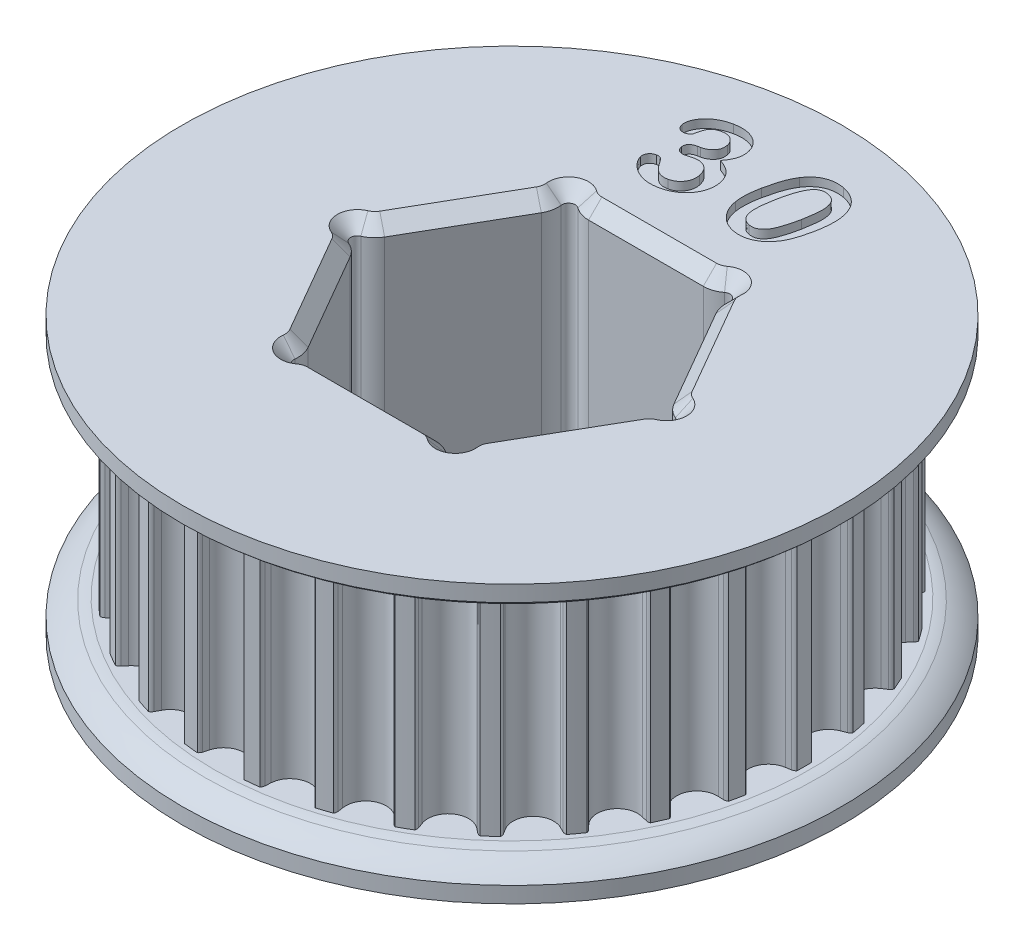
from build123d import *

# Parameters (mm, degrees)
SKETCH1_R               = 13.942945337
TOOTHOD_DEPTH           = 5.08
TOOTHPROFILE_DEPTH      = 21.362167108
TOOTHPATTERN_COUNT      = 30
BORE_DEPTH              = 24.192866588
BORE_DEPTH_BACK         = 24.192866588
LARGE_START             = 6.204
LARGE_TOOTH_COUNT_DEPTH = 0.4
SKETCH12_R              = 0.3175
CUT_EXTRUDE1_DEPTH      = 26.860153032
FILLET1_R               = 1.27
CHAMFER1_SIZE           = 0.635


# Read off the part's stored shape, not the designer's step: Large Tooth Count
with BuildPart() as part:
    # Sketch1 → ToothOD (new, symmetric)
    with BuildSketch(Plane(origin=(0, 0, 0), x_dir=(1, 0, 0), z_dir=(0, 1, 0))):
        with Locations(Location((0, 0, 0), (0, 0, 270))):
            Circle(SKETCH1_R)
    extrude(amount=TOOTHOD_DEPTH, both=True)

    # Sketch2 → ToothProfile (cut, symmetric)
    with BuildSketch(Plane(origin=(0, 0, 0), x_dir=(1, 0, 0), z_dir=(0, 1, 0))):
        with BuildLine():
            ThreePointArc((-0.937033068, 13.493007333), (-0.590385173, 12.974832723), (0, 12.774545337))
            ThreePointArc((0, 12.774545337), (0.590385173, 12.974832723), (0.937033068, 13.493007333))
            ThreePointArc((0.937033068, 13.493007333), (0.971699064, 13.619118795), (1.007805813, 13.744825337))
            ThreePointArc((1.007805813, 13.744825337), (1.04827578, 13.830028138), (1.113221937, 13.898433782))
            ThreePointArc((1.113221937, 13.898433782), (0, 13.942945337), (-1.113221937, 13.898433782))
            ThreePointArc((-1.113221937, 13.898433782), (-1.04827578, 13.830028138), (-1.007805813, 13.744825337))
            ThreePointArc((-1.007805813, 13.744825337), (-0.971699064, 13.619118795), (-0.937033068, 13.493007333))
        make_face()
    toothprofile = extrude(amount=TOOTHPROFILE_DEPTH, both=True, mode=Mode.SUBTRACT)

    # ToothPattern: ToothProfile ×30 about axis
    toothpattern_axis = Axis((0, 0, 0), (0, 1, 0))
    for i in range(1, TOOTHPATTERN_COUNT):
        add(toothprofile.rotate(toothpattern_axis, i * 360 / TOOTHPATTERN_COUNT), mode=Mode.SUBTRACT)

    # Sketch4 → Flange (revolve)
    with BuildSketch(Plane.XY, mode=Mode.PRIVATE) as flange_sk:
        with BuildLine():
            Line((0, -5.08), (14.196945337, -5.08))
            ThreePointArc((14.196945337, -5.08), (14.426591958, -5.115951298), (14.652017665, -5.172637424))
            ThreePointArc((14.652017665, -5.172637424), (15.219746242, -5.454197125), (15.720945337, -5.842))
            Line((15.720945337, -5.842), (15.720945337, -6.604))
            Line((15.720945337, -6.604), (0, -6.604))
            Line((0, -6.604), (0, -5.08))
        make_face()
        with BuildLine():
            Line((15.720945337, 6.604), (15.720945337, 5.842))
            ThreePointArc((15.720945337, 5.842), (15.219746242, 5.454197125), (14.652017665, 5.172637424))
            ThreePointArc((14.652017665, 5.172637424), (14.426591958, 5.115951298), (14.196945337, 5.08))
            Line((14.196945337, 5.08), (0, 5.08))
            Line((0, 5.08), (0, 6.604))
            Line((0, 6.604), (15.720945337, 6.604))
        make_face()
    revolve(flange_sk.sketch.rotate(Axis((0, 8.73125, 0), (0, -1, 0)), 90), axis=Axis((0, 8.73125, 0), (0, -1, 0)))

    # Sketch7 → Bore (cut, two sides: drawn at the far end of the back side and taken through both)
    with BuildSketch(Plane.XZ.offset(-BORE_DEPTH_BACK)):
        Polygon((3.688171255, 6.3881), (-3.688171255, 6.3881), (-7.376342509, 0), (-3.688171255, -6.3881), (3.688171255, -6.3881), (7.376342509, 0), align=None)
    extrude(amount=BORE_DEPTH + BORE_DEPTH_BACK, mode=Mode.SUBTRACT)

    # Large Tooth Count outline → Large Tooth Count (cut)
    # profile 1 of 2: a face of its own
    with BuildSketch(Plane(origin=(0, 0, 0), x_dir=(1, 0, 0), z_dir=(0, 1, 0)).offset(LARGE_START)):
        with BuildLine():
            add(Edge.make_bspline(
                [(3.79333125, 12.049422656), (3.80295948, 12.00370364), (3.822909298, 11.908973243), (3.839934178, 11.759322164), (3.847830972, 11.598568062), (3.845403862, 11.426870198), (3.834720655, 11.244188528), (3.813775106, 11.050562966), (3.783444974, 10.84559573), (3.75637949, 10.706002666), (3.742432031, 10.634067187)],
                knots=[0, 0, 0, 0, 0.098209665, 0.203491703, 0.316304971, 0.436495508, 0.564411761, 0.701005585, 0.845921381, 1, 1, 1, 1], degree=3))
            add(Edge.make_bspline(
                [(2.656582031, 13.166526562), (2.706206849, 13.155132675), (2.803280318, 13.132844548), (2.94259136, 13.086337807), (3.071736883, 13.028103956), (3.191370893, 12.958924604), (3.301133537, 12.879562268), (3.401403565, 12.790147143), (3.491932185, 12.691098378), (3.571195273, 12.581049527), (3.64270375, 12.462621366), (3.702802479, 12.333654233), (3.754304174, 12.195380289), (3.780133676, 12.098780354), (3.79333125, 12.049422656)],
                knots=[0, 0, 0, 0, 0.090152796, 0.176352178, 0.259651945, 0.340679802, 0.420727392, 0.499147058, 0.578272523, 0.657893561, 0.739002001, 0.822964899, 0.909543988, 1, 1, 1, 1], degree=3))
            add(Edge.make_bspline(
                [(1.173360938, 12.536090625), (1.19564708, 12.568475682), (1.239439637, 12.632112739), (1.309876572, 12.722043796), (1.385379435, 12.80326932), (1.463717976, 12.877766601), (1.546382669, 12.944036096), (1.632321887, 13.00315336), (1.721642673, 13.055310869), (1.815070316, 13.098996641), (1.911135191, 13.135579536), (2.010219263, 13.164530113), (2.111823638, 13.184843484), (2.216010824, 13.1974155), (2.322610005, 13.201900957), (2.431748708, 13.197738987), (2.543820042, 13.187862345), (2.61857504, 13.173717895), (2.656582031, 13.166526562)],
                knots=[0, 0, 0, 0, 0.068450482, 0.134506083, 0.198696985, 0.261397333, 0.32259497, 0.382979431, 0.44289939, 0.502488886, 0.562366234, 0.621745712, 0.682025526, 0.742587693, 0.804322948, 0.86759274, 0.932681402, 1, 1, 1, 1], degree=3))
            add(Edge.make_bspline(
                [(0.702766406, 11.194851563), (0.717518862, 11.26519424), (0.746304912, 11.402451919), (0.795571225, 11.601658214), (0.847978183, 11.789071165), (0.90385964, 11.964480499), (0.96446555, 12.126861213), (1.028594768, 12.276407029), (1.09639016, 12.412817483), (1.14831297, 12.495974859), (1.173360938, 12.536090625)],
                knots=[0, 0, 0, 0, 0.150859184, 0.294367262, 0.430657714, 0.559291409, 0.680684962, 0.794312984, 0.900774981, 1, 1, 1, 1], degree=3))
            add(Edge.make_bspline(
                [(0.644723437, 10.008096094), (0.638642526, 10.051800398), (0.62630634, 10.140462185), (0.615500251, 10.276683221), (0.613264488, 10.417696474), (0.617724523, 10.563713236), (0.629736602, 10.714706791), (0.647630451, 10.870765397), (0.671603874, 11.031631495), (0.692265669, 11.139851826), (0.702766406, 11.194851563)],
                knots=[0, 0, 0, 0, 0.110816528, 0.224810611, 0.342958202, 0.464879995, 0.591603543, 0.723291302, 0.859371106, 1, 1, 1, 1], degree=3))
            add(Edge.make_bspline(
                [(1.794867187, 8.76061875), (1.757796481, 8.76895007), (1.68470395, 8.785376984), (1.578692012, 8.82022096), (1.476675673, 8.860522245), (1.379895209, 8.910638347), (1.286656653, 8.96627254), (1.199065463, 9.031260904), (1.11583816, 9.102909474), (1.037001008, 9.181177406), (0.965366205, 9.26703746), (0.89879616, 9.357482146), (0.838782928, 9.453126056), (0.786187527, 9.554158241), (0.740572541, 9.660223984), (0.701101372, 9.771069082), (0.668904031, 9.887535787), (0.652864919, 9.96750406), (0.644723437, 10.008096094)],
                knots=[0, 0, 0, 0, 0.063013357, 0.124243807, 0.184962126, 0.244824632, 0.304882435, 0.36494633, 0.425537954, 0.487006996, 0.549046882, 0.61088984, 0.673245472, 0.736208478, 0.799702013, 0.864689897, 0.931316357, 1, 1, 1, 1], degree=3))
            add(Edge.make_bspline(
                [(3.180754687, 9.264253125), (3.157871319, 9.238339502), (3.112408772, 9.186856728), (3.039152131, 9.116067869), (2.9637652, 9.050064281), (2.885426692, 8.990658812), (2.8048367, 8.936587878), (2.721160657, 8.88907576), (2.63496381, 8.847278953), (2.517451736, 8.799676867), (2.365781878, 8.756326636), (2.178312896, 8.730516303), (1.986365835, 8.729537419), (1.859281577, 8.750163925), (1.794867187, 8.76061875)],
                knots=[0, 0, 0, 0, 0.066903371, 0.132917389, 0.197045886, 0.260779646, 0.323109482, 0.384791342, 0.446902374, 0.508430619, 0.630088147, 0.75110531, 0.873844332, 1, 1, 1, 1], degree=3))
            add(Edge.make_bspline(
                [(3.742432031, 10.634067187), (3.726295378, 10.558340978), (3.695171685, 10.412283466), (3.641678743, 10.203431187), (3.584650967, 10.012311882), (3.523425044, 9.837691486), (3.454100306, 9.677001753), (3.374462336, 9.528516449), (3.284684763, 9.389781631), (3.215227641, 9.305890142), (3.180754687, 9.264253125)],
                knots=[0, 0, 0, 0, 0.155098438, 0.29914731, 0.431769474, 0.554551464, 0.669651875, 0.781967595, 0.891786174, 1, 1, 1, 1], degree=3))
        make_face()
        with BuildLine():
            add(Edge.make_bspline(
                [(1.913632031, 9.391054688), (1.936191106, 9.38694552), (1.980185713, 9.37893184), (2.045763475, 9.376169625), (2.108911071, 9.377120318), (2.169393074, 9.386316528), (2.227667826, 9.401443932), (2.282542724, 9.423991977), (2.335506687, 9.451969145), (2.403091961, 9.499508781), (2.481822438, 9.575759873), (2.568295205, 9.6856682), (2.644534424, 9.81897376), (2.700601492, 9.944710055), (2.743549964, 10.056346982), (2.775688425, 10.14928192), (2.806502535, 10.249549545), (2.83842757, 10.356386286), (2.8666493, 10.470972631), (2.898301591, 10.591595098), (2.925859938, 10.719988705), (2.944440044, 10.807895221), (2.953940625, 10.852844531)],
                knots=[0, 0, 0, 0, 0.034322192, 0.066934986, 0.09817343, 0.128833214, 0.15837243, 0.188193233, 0.21752966, 0.247971246, 0.311715644, 0.380966107, 0.456937588, 0.541184412, 0.5870788, 0.636172085, 0.688515898, 0.744276078, 0.803241566, 0.865343089, 0.931145772, 1, 1, 1, 1], degree=3))
            add(Edge.make_bspline(
                [(1.519832813, 11.11805625), (1.511017323, 11.074037933), (1.493773916, 10.98793656), (1.471625542, 10.861374205), (1.452620291, 10.740537153), (1.437576544, 10.625256237), (1.425232976, 10.51569431), (1.414584888, 10.411887693), (1.409872652, 10.313826042), (1.405715218, 10.193850961), (1.409976085, 10.055502488), (1.432295682, 9.903419688), (1.467453367, 9.768934219), (1.520446003, 9.652923922), (1.590923619, 9.555124537), (1.681918125, 9.47873684), (1.790886115, 9.421901023), (1.871680589, 9.401597183), (1.913632031, 9.391054688)],
                knots=[0, 0, 0, 0, 0.068200355, 0.133402288, 0.195185331, 0.254025261, 0.31000668, 0.362698789, 0.412516234, 0.459113992, 0.545092877, 0.622348653, 0.692232855, 0.755558915, 0.815072705, 0.873785642, 0.934464896, 1, 1, 1, 1], degree=3))
            add(Edge.make_bspline(
                [(2.542282031, 12.535197656), (2.510228965, 12.540610223), (2.447897413, 12.551135695), (2.355155361, 12.55080467), (2.267169473, 12.538045332), (2.185158847, 12.509404991), (2.107646091, 12.469091598), (2.037103622, 12.413069325), (1.969950233, 12.345664248), (1.909739947, 12.262917379), (1.852355154, 12.167472424), (1.79856556, 12.058011501), (1.745774289, 11.935645626), (1.69597424, 11.798941812), (1.64794977, 11.64852004), (1.602960636, 11.483881359), (1.558685897, 11.305992894), (1.533083611, 11.182151822), (1.519832813, 11.11805625)],
                knots=[0, 0, 0, 0, 0.049883832, 0.097005903, 0.141910465, 0.185891973, 0.229892514, 0.27555509, 0.323757438, 0.375729045, 0.432377302, 0.494779801, 0.563021864, 0.637130541, 0.718298347, 0.805651304, 0.899412281, 1, 1, 1, 1], degree=3))
            add(Edge.make_bspline(
                [(2.953940625, 10.852844531), (2.970100217, 10.936663066), (3.000891971, 11.096377469), (3.034227598, 11.326082692), (3.054181678, 11.533507079), (3.062586089, 11.719587665), (3.05642304, 11.885890677), (3.034730753, 12.033797688), (2.997872968, 12.164190151), (2.944472978, 12.277221692), (2.872316409, 12.372256405), (2.780543414, 12.448028722), (2.668852714, 12.504640553), (2.585717069, 12.524711429), (2.542282031, 12.535197656)],
                knots=[0, 0, 0, 0, 0.132037801, 0.251595171, 0.358900261, 0.454285871, 0.539549896, 0.615937084, 0.685005529, 0.748434951, 0.808205655, 0.86804549, 0.931059066, 1, 1, 1, 1], degree=3))
        make_face(mode=Mode.SUBTRACT)
    # profile 2 of 2: a face of its own
    with BuildSketch(Plane(origin=(0, 0, 0), x_dir=(1, 0, 0), z_dir=(0, 1, 0)).offset(LARGE_START)):
        with BuildLine():
            add(Edge.make_bspline(
                [(-2.907567822, 10.987652963), (-2.911020111, 11.0117193), (-2.917671531, 11.058087185), (-2.909874272, 11.12733624), (-2.888474163, 11.192085305), (-2.850548449, 11.251221072), (-2.797912661, 11.303833895), (-2.728632533, 11.346660506), (-2.645208595, 11.381637982), (-2.583123729, 11.395547556), (-2.550380322, 11.402883432)],
                knots=[0, 0, 0, 0, 0.117439719, 0.226267565, 0.334404554, 0.445288529, 0.563637655, 0.692116396, 0.837622945, 1, 1, 1, 1], degree=3))
            add(Edge.make_bspline(
                [(-2.50216001, 10.734942807), (-2.527973056, 10.730888299), (-2.577047848, 10.723180021), (-2.649199277, 10.724266576), (-2.714239947, 10.739555135), (-2.772002705, 10.766694832), (-2.821456645, 10.805967518), (-2.860822936, 10.85700761), (-2.891202858, 10.918311476), (-2.901945548, 10.963830309), (-2.907567822, 10.987652963)],
                knots=[0, 0, 0, 0, 0.144370241, 0.274471271, 0.396265647, 0.511142994, 0.624786851, 0.742034498, 0.864991642, 1, 1, 1, 1], degree=3))
            add(Edge.make_bspline(
                [(-2.164617822, 10.826918588), (-2.17565662, 10.8246444), (-2.20055828, 10.819514218), (-2.241434525, 10.808233563), (-2.290749354, 10.795261624), (-2.344285921, 10.778595394), (-2.396920901, 10.763963975), (-2.441224432, 10.74997546), (-2.475255472, 10.741016464), (-2.494412337, 10.736691831), (-2.50216001, 10.734942807)],
                knots=[0, 0, 0, 0, 0.096592829, 0.217897078, 0.363363739, 0.53371412, 0.698449031, 0.831649283, 0.931913378, 1, 1, 1, 1], degree=3))
            add(Edge.make_bspline(
                [(-1.301117041, 10.242917025), (-1.307193042, 10.270426788), (-1.319078446, 10.324239262), (-1.344395643, 10.400845048), (-1.373721462, 10.472174756), (-1.408552622, 10.537307788), (-1.448138758, 10.596962589), (-1.492718946, 10.650911137), (-1.543296187, 10.698240919), (-1.597791303, 10.740449525), (-1.65650148, 10.776492507), (-1.719650926, 10.803805257), (-1.785369718, 10.825463875), (-1.854654836, 10.841158103), (-1.927836848, 10.847780177), (-2.003990776, 10.847430107), (-2.08350986, 10.841478355), (-2.137002976, 10.831875755), (-2.164617822, 10.826918588)],
                knots=[0, 0, 0, 0, 0.071431919, 0.139729604, 0.204381507, 0.26688073, 0.326780298, 0.385758869, 0.443983301, 0.502134232, 0.560412505, 0.618224132, 0.676252356, 0.735798644, 0.79801438, 0.862201554, 0.928864065, 1, 1, 1, 1], degree=3))
            add(Edge.make_bspline(
                [(-1.894048291, 9.334767807), (-1.864034942, 9.342019437), (-1.803997056, 9.356525402), (-1.718095519, 9.392549277), (-1.63500257, 9.436859605), (-1.557697471, 9.493553506), (-1.485897505, 9.559355048), (-1.42299477, 9.635466912), (-1.371273193, 9.721676475), (-1.328044272, 9.815001877), (-1.297540124, 9.915869027), (-1.282251505, 10.022090362), (-1.283288558, 10.132227454), (-1.295093074, 10.205516743), (-1.301117041, 10.242917025)],
                knots=[0, 0, 0, 0, 0.076639119, 0.153306805, 0.2307807, 0.310256727, 0.390888456, 0.472361089, 0.554715906, 0.640137892, 0.727448796, 0.81565797, 0.905928356, 1, 1, 1, 1], degree=3))
            add(Edge.make_bspline(
                [(-2.879885791, 9.966989682), (-2.842161736, 9.908262428), (-2.770950625, 9.797403906), (-2.655412662, 9.650785089), (-2.54596033, 9.527581873), (-2.451776394, 9.444971426), (-2.375369029, 9.393354819), (-2.315693796, 9.364105015), (-2.253411391, 9.340303937), (-2.187200301, 9.32571391), (-2.118488066, 9.316115802), (-2.046352828, 9.316180502), (-1.971002158, 9.320986547), (-1.92017782, 9.330088408), (-1.894048291, 9.334767807)],
                knots=[0, 0, 0, 0, 0.165494384, 0.312401169, 0.442363846, 0.556028008, 0.608516533, 0.660623665, 0.713353888, 0.766282329, 0.82111266, 0.877609238, 0.937077136, 1, 1, 1, 1], degree=3))
            add(Edge.make_bspline(
                [(-3.171886572, 10.069681088), (-3.14385434, 10.073198771), (-3.086866668, 10.080349987), (-3.016159411, 10.062377337), (-2.963653751, 10.040866753), (-2.929245884, 10.020200304), (-2.900553642, 9.996098825), (-2.886665266, 9.976538072), (-2.879885791, 9.966989682)],
                knots=[0, 0, 0, 0, 0.25801308, 0.524523507, 0.658326607, 0.779999686, 0.892608999, 1, 1, 1, 1], degree=3))
            add(Edge.make_bspline(
                [(-3.484425635, 9.618731869), (-3.488513103, 9.645754524), (-3.496408536, 9.697952022), (-3.48974961, 9.775572612), (-3.468299589, 9.848133199), (-3.429821823, 9.91311879), (-3.380453131, 9.970640358), (-3.31883733, 10.015524204), (-3.249260159, 10.05065411), (-3.198127535, 10.063228159), (-3.171886572, 10.069681088)],
                knots=[0, 0, 0, 0, 0.132938278, 0.256786215, 0.37668058, 0.498977948, 0.622467818, 0.743865292, 0.868553173, 1, 1, 1, 1], degree=3))
            add(Edge.make_bspline(
                [(-1.785106104, 8.762374838), (-1.842999642, 8.752308355), (-1.956153802, 8.732633199), (-2.125300666, 8.722845227), (-2.288444786, 8.730704508), (-2.444641373, 8.755666495), (-2.591695194, 8.795800035), (-2.729678863, 8.843977586), (-2.856373936, 8.904247923), (-2.971592963, 8.974130076), (-3.075959637, 9.05099133), (-3.169580085, 9.132350915), (-3.253766646, 9.216384507), (-3.32505813, 9.303984015), (-3.384238734, 9.390405459), (-3.430828516, 9.471567902), (-3.466028682, 9.546153589), (-3.478556953, 9.595579184), (-3.484425635, 9.618731869)],
                knots=[0, 0, 0, 0, 0.084858105, 0.165856982, 0.244232561, 0.320459077, 0.393907119, 0.464241528, 0.531385461, 0.596223663, 0.658678463, 0.718440469, 0.775314216, 0.830331254, 0.881391247, 0.926470742, 0.965556313, 1, 1, 1, 1], degree=3))
            add(Edge.make_bspline(
                [(-0.510839697, 10.452764682), (-0.503345139, 10.408226317), (-0.4883779, 10.319279609), (-0.482909614, 10.183935204), (-0.489690789, 10.048099299), (-0.511439263, 9.912933302), (-0.545857927, 9.779535454), (-0.595588259, 9.650001857), (-0.659364222, 9.524844107), (-0.736159432, 9.404060105), (-0.826203591, 9.290058739), (-0.928884195, 9.183964629), (-1.043609397, 9.086335449), (-1.17039691, 8.998137733), (-1.308403836, 8.920151261), (-1.457259536, 8.854056962), (-1.616837008, 8.799845892), (-1.72827521, 8.775030242), (-1.785106104, 8.762374838)],
                knots=[0, 0, 0, 0, 0.057352876, 0.11453832, 0.171742531, 0.229957309, 0.28822369, 0.346537948, 0.405922237, 0.466475902, 0.528158226, 0.590227966, 0.653829397, 0.719315559, 0.786228555, 0.854984433, 0.926045431, 1, 1, 1, 1], degree=3))
            add(Edge.make_bspline(
                [(-1.420774854, 11.3609139), (-1.379768236, 11.34753806), (-1.299429209, 11.321332485), (-1.185212143, 11.272428436), (-1.07793184, 11.219447087), (-0.980039443, 11.158069696), (-0.888760645, 11.092819194), (-0.808706982, 11.018421497), (-0.735057632, 10.940254777), (-0.673108733, 10.853530761), (-0.617889125, 10.762256205), (-0.572376758, 10.664699496), (-0.53634402, 10.561034633), (-0.519434889, 10.489252654), (-0.510839697, 10.452764682)],
                knots=[0, 0, 0, 0, 0.095378747, 0.186863396, 0.274624743, 0.359785527, 0.4422375, 0.522414957, 0.60117637, 0.67941575, 0.757680067, 0.836927252, 0.917107413, 1, 1, 1, 1], degree=3))
            add(Edge.make_bspline(
                [(-1.113593604, 12.373540463), (-1.105535205, 12.326056531), (-1.089847899, 12.233619444), (-1.087064846, 12.096209008), (-1.10318767, 11.966079741), (-1.137133506, 11.842223594), (-1.187816437, 11.722295891), (-1.251857629, 11.602129272), (-1.329803096, 11.480501796), (-1.38984058, 11.401578881), (-1.420774854, 11.3609139)],
                knots=[0, 0, 0, 0, 0.131486853, 0.25596578, 0.374011465, 0.488659132, 0.6057311, 0.729086035, 0.860411758, 1, 1, 1, 1], degree=3))
            add(Edge.make_bspline(
                [(-2.607530322, 13.176319369), (-2.560603325, 13.184752448), (-2.468650078, 13.20127703), (-2.331284582, 13.213858274), (-2.198353877, 13.214855069), (-2.069985509, 13.204798226), (-1.946984279, 13.185861458), (-1.829771384, 13.155139566), (-1.719053842, 13.114235668), (-1.615102318, 13.063050887), (-1.518700327, 13.003374449), (-1.430328654, 12.93552939), (-1.352606305, 12.858275837), (-1.284327418, 12.773647035), (-1.225348563, 12.68281314), (-1.17672779, 12.585531492), (-1.138776026, 12.482117817), (-1.12206508, 12.410066355), (-1.113593604, 12.373540463)],
                knots=[0, 0, 0, 0, 0.075293483, 0.147537249, 0.217601167, 0.285040851, 0.350750214, 0.413934509, 0.476124159, 0.53689869, 0.596660669, 0.654975167, 0.712497532, 0.76933742, 0.826464438, 0.883242051, 0.940810524, 1, 1, 1, 1], degree=3))
            add(Edge.make_bspline(
                [(-3.81661001, 11.923484213), (-3.820713069, 11.949317661), (-3.82912174, 12.002259868), (-3.825988998, 12.084997352), (-3.813497883, 12.171602749), (-3.788966362, 12.261717468), (-3.753270358, 12.35412112), (-3.706109395, 12.44738096), (-3.649175891, 12.541355345), (-3.579871049, 12.634043286), (-3.500140483, 12.725822586), (-3.405607276, 12.810642647), (-3.300478307, 12.892097866), (-3.182717222, 12.966231518), (-3.054293041, 13.034665661), (-2.914447958, 13.092169923), (-2.764942756, 13.140962351), (-2.660737865, 13.164368216), (-2.607530322, 13.176319369)],
                knots=[0, 0, 0, 0, 0.041089621, 0.084207698, 0.129665656, 0.178652453, 0.230863189, 0.285345725, 0.342963863, 0.403597209, 0.4673357, 0.533998714, 0.60316391, 0.676475843, 0.752769812, 0.831957136, 0.914196467, 1, 1, 1, 1], degree=3))
            add(Edge.make_bspline(
                [(-3.43084751, 11.641306088), (-3.450471699, 11.638213026), (-3.48975346, 11.632021642), (-3.549812, 11.641049399), (-3.610068952, 11.658568392), (-3.668184834, 11.690064549), (-3.721793815, 11.732167268), (-3.765672035, 11.786397222), (-3.798386954, 11.851002048), (-3.810394163, 11.898760696), (-3.81661001, 11.923484213)],
                knots=[0, 0, 0, 0, 0.111646881, 0.223483692, 0.339493462, 0.465162893, 0.594417733, 0.722363323, 0.856274089, 1, 1, 1, 1], degree=3))
            add(Edge.make_bspline(
                [(-3.170100635, 11.813649057), (-3.173833151, 11.803604749), (-3.181378645, 11.783299604), (-3.201539595, 11.755758234), (-3.22755316, 11.730025822), (-3.271578939, 11.697463058), (-3.339271403, 11.663565469), (-3.399190782, 11.649000881), (-3.43084751, 11.641306088)],
                knots=[0, 0, 0, 0, 0.098163881, 0.198443932, 0.310752569, 0.433981497, 0.700959954, 1, 1, 1, 1], degree=3))
            add(Edge.make_bspline(
                [(-2.574490479, 12.587852963), (-2.603203999, 12.581524652), (-2.657948149, 12.569459325), (-2.734616678, 12.543950399), (-2.802654694, 12.515241124), (-2.861400447, 12.480798629), (-2.91176693, 12.443041018), (-2.955331162, 12.402437575), (-2.992180849, 12.35880138), (-3.032665066, 12.294097151), (-3.072701742, 12.199823524), (-3.109088165, 12.075055138), (-3.14020504, 11.943902763), (-3.160328727, 11.856224801), (-3.170100635, 11.813649057)],
                knots=[0, 0, 0, 0, 0.08290668, 0.158066849, 0.227652368, 0.290886539, 0.349675616, 0.404933264, 0.45859134, 0.510315093, 0.619720685, 0.746177872, 0.876745925, 1, 1, 1, 1], degree=3))
            add(Edge.make_bspline(
                [(-1.885118604, 12.163692807), (-1.894174968, 12.198992158), (-1.912021457, 12.268553123), (-1.962337537, 12.364149206), (-2.032066353, 12.446711136), (-2.117619011, 12.516044357), (-2.216854245, 12.569606088), (-2.328403516, 12.600247012), (-2.449742189, 12.60727195), (-2.53175235, 12.594505809), (-2.574490479, 12.587852963)],
                knots=[0, 0, 0, 0, 0.120495419, 0.23744849, 0.354430692, 0.476475465, 0.600506251, 0.725467584, 0.856932341, 1, 1, 1, 1], degree=3))
            add(Edge.make_bspline(
                [(-2.429829541, 11.427886557), (-2.386199616, 11.438323972), (-2.301039196, 11.458696565), (-2.183175442, 11.513588531), (-2.079238486, 11.586023186), (-2.004181225, 11.659532755), (-1.95384716, 11.726215117), (-1.922515471, 11.779793005), (-1.898004748, 11.836718375), (-1.881147238, 11.896790031), (-1.871314177, 11.959737259), (-1.868760103, 12.025331892), (-1.873436351, 12.093805214), (-1.881147102, 12.139933804), (-1.885118604, 12.163692807)],
                knots=[0, 0, 0, 0, 0.13045338, 0.254629467, 0.376126556, 0.498167231, 0.55887707, 0.619120502, 0.678565805, 0.738965105, 0.800419954, 0.863785083, 0.929841114, 1, 1, 1, 1], degree=3))
            Line((-2.429829541, 11.427886557), (-2.550380322, 11.402883432))
        make_face()
    extrude(amount=LARGE_TOOTH_COUNT_DEPTH, mode=Mode.SUBTRACT)

    # Sketch12 → Cut-Extrude1 (cut, through all)
    with BuildSketch(Plane(origin=(0, 6.604, 0), x_dir=(1, 0, 0), z_dir=(0, 1, 0))):
        with Locations((-3.688171255, 6.3881)):
            Circle(SKETCH12_R)
        with Locations((3.688171255, 6.3881)):
            Circle(SKETCH12_R)
        with Locations((7.376342509, 0)):
            Circle(SKETCH12_R)
        with Locations((3.688171255, -6.3881)):
            Circle(SKETCH12_R)
        with Locations((-3.688171255, -6.3881)):
            Circle(SKETCH12_R)
        with Locations((-7.376342509, 0)):
            Circle(SKETCH12_R)
    extrude(amount=-CUT_EXTRUDE1_DEPTH, mode=Mode.SUBTRACT)

    # Fillet1
    fillet1_edges = [part.edges().sort_by_distance(p)[0] for p in [
        (3.370671255, 0, 6.3881),
        (-3.370671255, 0, 6.3881),
        (-7.217592509, 0, 0.274963066),
        (-3.846921255, 0, -6.113136934),
        (3.370671255, 0, -6.3881),
        (7.217592509, 0, -0.274963066),
        (-7.217592509, 0, -0.274963066),
        (-3.846921255, 0, 6.113136934),
        (3.846921255, 0, 6.113136934),
        (7.217592509, 0, 0.274963066),
        (3.846921255, 0, -6.113136934),
        (-3.370671255, 0, -6.3881),
    ]]
    fillet(fillet1_edges, radius=FILLET1_R)

    # Chamfer1
    chamfer1_edges = [part.edges().sort_by_distance(p)[0] for p in [
        (-5.532256882, 6.604, -3.19405),
        (-5.532256882, -6.604, -3.19405),
        (-7.693842509, -6.604, 0),
        (-5.532256882, -6.604, 3.19405),
        (-3.846921255, -6.604, 6.663063066),
        (0, -6.604, 6.3881),
        (3.846921255, -6.604, 6.663063066),
        (5.532256882, -6.604, 3.19405),
        (7.693842509, -6.604, 0),
        (5.532256882, -6.604, -3.19405),
        (3.846921255, -6.604, -6.663063066),
        (0, -6.604, -6.3881),
        (-3.846921255, -6.604, -6.663063066),
        (-3.137280517, -6.604, -6.453272211),
        (-4.020057414, -6.604, -5.943600733),
        (3.137280517, -6.604, -6.453272211),
        (4.020057414, -6.604, -5.943600733),
        (7.157337931, -6.604, -0.509671479),
        (7.157337931, -6.604, 0.509671479),
        (3.137280517, -6.604, 6.453272211),
        (4.020057414, -6.604, 5.943600733),
        (-3.137280517, -6.604, 6.453272211),
        (-4.020057414, -6.604, 5.943600733),
        (-7.157337931, -6.604, 0.509671479),
        (-7.157337931, -6.604, -0.509671479),
        (-7.693842509, 6.604, 0),
        (-5.532256882, 6.604, 3.19405),
        (-3.846921255, 6.604, -6.663063066),
        (0, 6.604, -6.3881),
        (3.846921255, 6.604, -6.663063066),
        (5.532256882, 6.604, -3.19405),
        (7.693842509, 6.604, 0),
        (5.532256882, 6.604, 3.19405),
        (3.846921255, 6.604, 6.663063066),
        (0, 6.604, 6.3881),
        (-3.846921255, 6.604, 6.663063066),
        (-3.137280517, 6.604, -6.453272211),
        (-4.020057414, 6.604, -5.943600733),
        (3.137280517, 6.604, -6.453272211),
        (4.020057414, 6.604, -5.943600733),
        (7.157337931, 6.604, -0.509671479),
        (7.157337931, 6.604, 0.509671479),
        (3.137280517, 6.604, 6.453272211),
        (4.020057414, 6.604, 5.943600733),
        (-3.137280517, 6.604, 6.453272211),
        (-4.020057414, 6.604, 5.943600733),
        (-7.157337931, 6.604, 0.509671479),
        (-7.157337931, 6.604, -0.509671479),
    ]]
    chamfer(chamfer1_edges, length=CHAMFER1_SIZE)


solid = part.part
